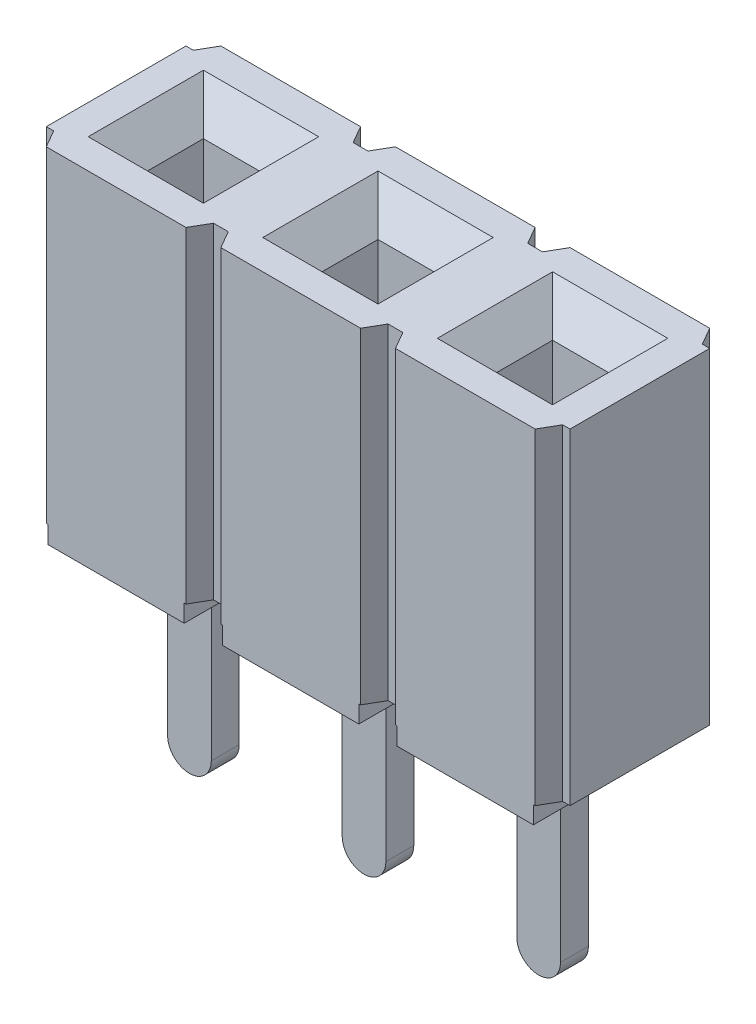
from build123d import *

# Parameters (mm, degrees)
SKETCH1_W                      = 40.64
SKETCH1_H                      = 2.54
BASE_EXTRUDE_DEPTH             = 5
SKETCH2_W                      = 1.524
SKETCH2_H                      = 0.254
STANDOFF_WIDTH_DEPTH           = 41.966114046
UPPER_START                    = -19.4945
UPPER_CORE_OUTLINE_W           = 3.3528
UPPER_CORE_OUTLINE_H           = 0.889
UPPER_CORE_DEPTH               = 0.889
LEAD_IN_SIZE                   = 0.3937
LEAD_IN_SIZE2                  = 0.469193389
CORE_PATTERN_COUNT             = 16
CORE_PATTERN_PITCH             = 2.54
LEAD_IN_OF_CORE_PATTERN_SIZE2  = 0.469193389
LEAD_IN_OF_CORE_PATTERN_SIZE   = 0.3937
POSITION_CUT_DEPTH             = 21.964620197
SKETCH10_W                     = 0.2794
SKETCH10_H                     = 0.254
STANDOFF_LENGTH_DEPTH          = 22.07970588
STANDOFF_PATTERN_COUNT         = 16
STANDOFF_PATTERN_PITCH         = 2.54
SKETCH11_W                     = 0.635
SKETCH11_H                     = 0.4064
TAIL_DEPTH                     = 3.175
TAIL_FILLETS_R                 = 0.3175
TAIL_PATTERN_COUNT             = 16
TAIL_PATTERN_PITCH             = 2.54
TAIL_FILLETS_OF_TAIL_PATTERN_R = 0.3175
SKETCH12_W                     = 33.02
SKETCH12_H                     = 7.921
CUT_EXTRUDE1_DEPTH             = 22.07970588


# Read off the part's stored shape, not the designer's step: Upper Core
with BuildPart() as part:
    # Sketch1 → Base-Extrude (new body)
    with BuildSketch(Plane(origin=(0, 0, 0), x_dir=(1, 0, 0), z_dir=(0, 1, 0))):
        Rectangle(SKETCH1_W, SKETCH1_H)
    extrude(amount=BASE_EXTRUDE_DEPTH)

    # Sketch2 → Standoff - Width (cut, through all)
    with BuildSketch(Plane.ZY.offset(20.32)):
        with Locations((0, 0.127)):
            Rectangle(SKETCH2_W, SKETCH2_H)
    extrude(amount=-STANDOFF_WIDTH_DEPTH, mode=Mode.SUBTRACT)

    # Upper Core outline → Upper Core (cut)
    with BuildSketch(Plane.YZ.offset(UPPER_START)):
        with Locations((3.3236, 0)):
            Rectangle(UPPER_CORE_OUTLINE_W, UPPER_CORE_OUTLINE_H)
    upper_core = extrude(amount=UPPER_CORE_DEPTH, mode=Mode.SUBTRACT)

    # Lead-in
    lead_in_edges = [part.edges().sort_by_distance(p)[0] for p in [
        (-19.4945, 5, 0),
        (-19.05, 5, 0.4445),
        (-18.6055, 5, 0),
        (-19.05, 5, -0.4445),
    ]]
    lead_in_side = [part.faces().sort_by_distance(p)[0] for p in [
        (0.146976854, 5, 0),
    ]]
    chamfer(lead_in_edges, length=LEAD_IN_SIZE, length2=LEAD_IN_SIZE2, reference=lead_in_side[0])

    # Core Pattern: Upper Core ×16
    with Locations(*[(i * CORE_PATTERN_PITCH, 0, 0) for i in range(1, CORE_PATTERN_COUNT)]):
        add(upper_core, mode=Mode.SUBTRACT)

    # Lead-in of Core Pattern
    lead_in_of_core_pattern_edges = [part.edges().sort_by_distance(p)[0] for p in [
        (-16.9545, 5, 0),
        (-16.51, 5, 0.4445),
        (-16.0655, 5, 0),
        (-16.51, 5, -0.4445),
        (-14.4145, 5, 0),
        (-13.97, 5, 0.4445),
        (-13.5255, 5, 0),
        (-13.97, 5, -0.4445),
        (-11.8745, 5, 0),
        (-11.43, 5, 0.4445),
        (-10.9855, 5, 0),
        (-11.43, 5, -0.4445),
        (-9.3345, 5, 0),
        (-8.89, 5, 0.4445),
        (-8.4455, 5, 0),
        (-8.89, 5, -0.4445),
        (-6.7945, 5, 0),
        (-6.35, 5, 0.4445),
        (-5.9055, 5, 0),
        (-6.35, 5, -0.4445),
        (-4.2545, 5, 0),
        (-3.81, 5, 0.4445),
        (-3.3655, 5, 0),
        (-3.81, 5, -0.4445),
        (-1.7145, 5, 0),
        (-1.27, 5, 0.4445),
        (-0.8255, 5, 0),
        (-1.27, 5, -0.4445),
        (0.8255, 5, 0),
        (1.27, 5, 0.4445),
        (1.7145, 5, 0),
        (1.27, 5, -0.4445),
        (3.3655, 5, 0),
        (3.81, 5, 0.4445),
        (4.2545, 5, 0),
        (3.81, 5, -0.4445),
        (5.9055, 5, 0),
        (6.35, 5, 0.4445),
        (6.7945, 5, 0),
        (6.35, 5, -0.4445),
        (8.4455, 5, 0),
        (8.89, 5, 0.4445),
        (9.3345, 5, 0),
        (8.89, 5, -0.4445),
        (10.9855, 5, 0),
        (11.43, 5, 0.4445),
        (11.8745, 5, 0),
        (11.43, 5, -0.4445),
        (13.5255, 5, 0),
        (13.97, 5, 0.4445),
        (14.4145, 5, 0),
        (13.97, 5, -0.4445),
        (16.0655, 5, 0),
        (16.51, 5, 0.4445),
        (16.9545, 5, 0),
        (16.51, 5, -0.4445),
        (18.6055, 5, 0),
        (19.05, 5, 0.4445),
        (19.4945, 5, 0),
        (19.05, 5, -0.4445),
    ]]
    chamfer(lead_in_of_core_pattern_edges, length=LEAD_IN_OF_CORE_PATTERN_SIZE, length2=LEAD_IN_OF_CORE_PATTERN_SIZE2)

    # Sketch4 → Position Cut (cut, through all)
    with BuildSketch(Plane(origin=(0, 5, 0), x_dir=(-1, 0, 0), z_dir=(0, 1, 0))):
        Polygon((20.32, 1.016), (20.212646968, 1.016), (20.066, 1.27), (20.32, 1.27), align=None)
        Polygon((20.066, -1.27), (20.32, -1.27), (20.32, -1.016), (20.212646968, -1.016), align=None)
        Polygon((17.78, -1.016), (17.887353032, -1.016), (18.034, -1.27), (17.78, -1.27), align=None)
        Polygon((18.034, 1.27), (17.78, 1.27), (17.78, 1.016), (17.887353032, 1.016), align=None)
    position_cut = extrude(amount=-POSITION_CUT_DEPTH, mode=Mode.SUBTRACT)

    # Sketch10 → Standoff - Length (cut, through all)
    with BuildSketch(Plane.XY.offset(1.27)):
        with Locations((-17.9197, 0.127)):
            Rectangle(SKETCH10_W, SKETCH10_H)
        with Locations((-20.1803, 0.127)):
            Rectangle(SKETCH10_W, SKETCH10_H)
    standoff_length = extrude(amount=-STANDOFF_LENGTH_DEPTH, mode=Mode.SUBTRACT)

    # Standoff Pattern: Position Cut, Standoff - Length ×16
    with Locations(*[(i * STANDOFF_PATTERN_PITCH, 0, 0) for i in range(1, STANDOFF_PATTERN_COUNT)]):
        add(position_cut, mode=Mode.SUBTRACT)
        add(standoff_length, mode=Mode.SUBTRACT)

    # Sketch11 → Tail (add)
    with BuildSketch(Plane.XZ.offset(-0.254)):
        with Locations((-19.05, 0)):
            Rectangle(SKETCH11_W, SKETCH11_H)
    tail = extrude(amount=TAIL_DEPTH)

    # Tail Fillets
    tail_fillets_edges = [part.edges().sort_by_distance(p)[0] for p in [
        (-19.3675, -2.921, 0),
        (-18.7325, -2.921, 0),
    ]]
    fillet(tail_fillets_edges, radius=TAIL_FILLETS_R - 0.0001)  # a hair under: the kernel refuses the full size

    # Tail Pattern: Tail ×16
    with Locations(*[(i * TAIL_PATTERN_PITCH, 0, 0) for i in range(1, TAIL_PATTERN_COUNT)]):
        add(tail)

    # Tail Fillets of Tail Pattern
    tail_fillets_of_tail_pattern_edges = [part.edges().sort_by_distance(p)[0] for p in [
        (-16.8275, -2.921, 0),
        (-16.1925, -2.921, 0),
        (-14.2875, -2.921, 0),
        (-13.6525, -2.921, 0),
        (-11.7475, -2.921, 0),
        (-11.1125, -2.921, 0),
        (-9.2075, -2.921, 0),
        (-8.5725, -2.921, 0),
        (-6.6675, -2.921, 0),
        (-6.0325, -2.921, 0),
        (-4.1275, -2.921, 0),
        (-3.4925, -2.921, 0),
        (-1.5875, -2.921, 0),
        (-0.9525, -2.921, 0),
        (0.9525, -2.921, 0),
        (1.5875, -2.921, 0),
        (3.4925, -2.921, 0),
        (4.1275, -2.921, 0),
        (6.0325, -2.921, 0),
        (6.6675, -2.921, 0),
        (8.5725, -2.921, 0),
        (9.2075, -2.921, 0),
        (11.1125, -2.921, 0),
        (11.7475, -2.921, 0),
        (13.6525, -2.921, 0),
        (14.2875, -2.921, 0),
        (16.1925, -2.921, 0),
        (16.8275, -2.921, 0),
        (18.7325, -2.921, 0),
        (19.3675, -2.921, 0),
    ]]
    fillet(tail_fillets_of_tail_pattern_edges, radius=TAIL_FILLETS_OF_TAIL_PATTERN_R - 0.0001)  # a hair under: the kernel refuses the full size

    # Sketch12 → Cut-Extrude1 (cut, through all)
    with BuildSketch(Plane.XY.offset(1.27)):
        with Locations((3.81, 1.0395)):
            Rectangle(SKETCH12_W, SKETCH12_H)
    extrude(amount=-CUT_EXTRUDE1_DEPTH, mode=Mode.SUBTRACT)


solid = part.part
